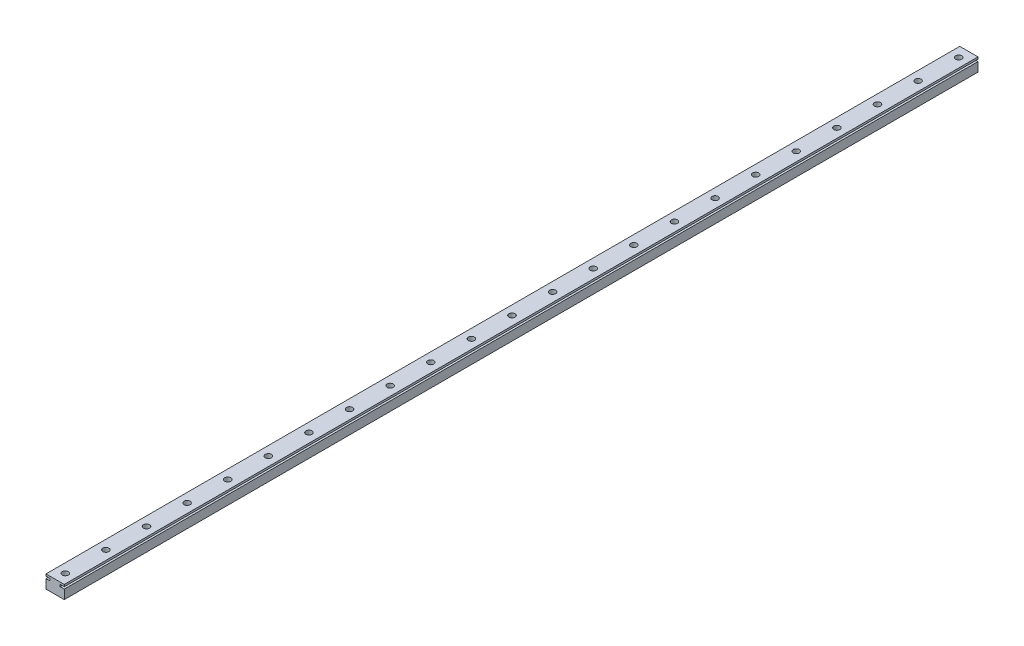
from build123d import *

# Parameters (mm, degrees)
SKETCH_1_W          = 9
SKETCH_1_H          = 6.5
EXTRUDE_1_DEPTH     = 450
SKETCH_2_W          = 2
SKETCH_2_H          = 1
CUT_EXTRUDE_1_DEPTH = 450
CUT_EXTRUDE_2_REACH = 452.137
SKETCH_3_R          = 1.5


with BuildPart() as part:
    # 草图1 → 凸台-拉伸1 (new body)
    with BuildSketch(Plane.XY):
        with Locations((-4.5, 3.25)):
            Rectangle(SKETCH_1_W, SKETCH_1_H)
    extrude(amount=EXTRUDE_1_DEPTH)

    # 草图2 → 切除-拉伸1 (cut)
    with BuildSketch(Plane(origin=(0, 0, 0), x_dir=(-1, 0, 0), z_dir=(0, 0, -1))):
        with Locations((1, 5)):
            Rectangle(SKETCH_2_W, SKETCH_2_H)
        with Locations((8, 5)):
            Rectangle(SKETCH_2_W, SKETCH_2_H)
    extrude(amount=-CUT_EXTRUDE_1_DEPTH, mode=Mode.SUBTRACT)

    # 草图3 → 切除-拉伸2 (cut, up to next)
    with BuildSketch(Plane(origin=(0, 6.5, 0), x_dir=(1, 0, 0), z_dir=(0, 1, 0)), mode=Mode.PRIVATE) as cut_extrude_2_sk1:
        with Locations((-4.5, -5)):
            Circle(SKETCH_3_R)
    cut_extrude_2_tool1 = extrude(cut_extrude_2_sk1.sketch, amount=-CUT_EXTRUDE_2_REACH, mode=Mode.PRIVATE) & part.part
    # 草图3 → 切除-拉伸2 (cut, up to next)
    with BuildSketch(Plane(origin=(0, 6.5, 0), x_dir=(1, 0, 0), z_dir=(0, 1, 0)), mode=Mode.PRIVATE) as cut_extrude_2_sk2:
        with Locations((-4.5, -25)):
            Circle(SKETCH_3_R)
    cut_extrude_2_tool2 = extrude(cut_extrude_2_sk2.sketch, amount=-CUT_EXTRUDE_2_REACH, mode=Mode.PRIVATE) & part.part
    # 草图3 → 切除-拉伸2 (cut, up to next)
    with BuildSketch(Plane(origin=(0, 6.5, 0), x_dir=(1, 0, 0), z_dir=(0, 1, 0)), mode=Mode.PRIVATE) as cut_extrude_2_sk3:
        with Locations((-4.5, -45)):
            Circle(SKETCH_3_R)
    cut_extrude_2_tool3 = extrude(cut_extrude_2_sk3.sketch, amount=-CUT_EXTRUDE_2_REACH, mode=Mode.PRIVATE) & part.part
    # 草图3 → 切除-拉伸2 (cut, up to next)
    with BuildSketch(Plane(origin=(0, 6.5, 0), x_dir=(1, 0, 0), z_dir=(0, 1, 0)), mode=Mode.PRIVATE) as cut_extrude_2_sk4:
        with Locations((-4.5, -65)):
            Circle(SKETCH_3_R)
    cut_extrude_2_tool4 = extrude(cut_extrude_2_sk4.sketch, amount=-CUT_EXTRUDE_2_REACH, mode=Mode.PRIVATE) & part.part
    # 草图3 → 切除-拉伸2 (cut, up to next)
    with BuildSketch(Plane(origin=(0, 6.5, 0), x_dir=(1, 0, 0), z_dir=(0, 1, 0)), mode=Mode.PRIVATE) as cut_extrude_2_sk5:
        with Locations((-4.5, -85)):
            Circle(SKETCH_3_R)
    cut_extrude_2_tool5 = extrude(cut_extrude_2_sk5.sketch, amount=-CUT_EXTRUDE_2_REACH, mode=Mode.PRIVATE) & part.part
    # 草图3 → 切除-拉伸2 (cut, up to next)
    with BuildSketch(Plane(origin=(0, 6.5, 0), x_dir=(1, 0, 0), z_dir=(0, 1, 0)), mode=Mode.PRIVATE) as cut_extrude_2_sk6:
        with Locations((-4.5, -105)):
            Circle(SKETCH_3_R)
    cut_extrude_2_tool6 = extrude(cut_extrude_2_sk6.sketch, amount=-CUT_EXTRUDE_2_REACH, mode=Mode.PRIVATE) & part.part
    # 草图3 → 切除-拉伸2 (cut, up to next)
    with BuildSketch(Plane(origin=(0, 6.5, 0), x_dir=(1, 0, 0), z_dir=(0, 1, 0)), mode=Mode.PRIVATE) as cut_extrude_2_sk7:
        with Locations((-4.5, -125)):
            Circle(SKETCH_3_R)
    cut_extrude_2_tool7 = extrude(cut_extrude_2_sk7.sketch, amount=-CUT_EXTRUDE_2_REACH, mode=Mode.PRIVATE) & part.part
    # 草图3 → 切除-拉伸2 (cut, up to next)
    with BuildSketch(Plane(origin=(0, 6.5, 0), x_dir=(1, 0, 0), z_dir=(0, 1, 0)), mode=Mode.PRIVATE) as cut_extrude_2_sk8:
        with Locations((-4.5, -145)):
            Circle(SKETCH_3_R)
    cut_extrude_2_tool8 = extrude(cut_extrude_2_sk8.sketch, amount=-CUT_EXTRUDE_2_REACH, mode=Mode.PRIVATE) & part.part
    # 草图3 → 切除-拉伸2 (cut, up to next)
    with BuildSketch(Plane(origin=(0, 6.5, 0), x_dir=(1, 0, 0), z_dir=(0, 1, 0)), mode=Mode.PRIVATE) as cut_extrude_2_sk9:
        with Locations((-4.5, -165)):
            Circle(SKETCH_3_R)
    cut_extrude_2_tool9 = extrude(cut_extrude_2_sk9.sketch, amount=-CUT_EXTRUDE_2_REACH, mode=Mode.PRIVATE) & part.part
    # 草图3 → 切除-拉伸2 (cut, up to next)
    with BuildSketch(Plane(origin=(0, 6.5, 0), x_dir=(1, 0, 0), z_dir=(0, 1, 0)), mode=Mode.PRIVATE) as cut_extrude_2_sk10:
        with Locations((-4.5, -185)):
            Circle(SKETCH_3_R)
    cut_extrude_2_tool10 = extrude(cut_extrude_2_sk10.sketch, amount=-CUT_EXTRUDE_2_REACH, mode=Mode.PRIVATE) & part.part
    # 草图3 → 切除-拉伸2 (cut, up to next)
    with BuildSketch(Plane(origin=(0, 6.5, 0), x_dir=(1, 0, 0), z_dir=(0, 1, 0)), mode=Mode.PRIVATE) as cut_extrude_2_sk11:
        with Locations((-4.5, -205)):
            Circle(SKETCH_3_R)
    cut_extrude_2_tool11 = extrude(cut_extrude_2_sk11.sketch, amount=-CUT_EXTRUDE_2_REACH, mode=Mode.PRIVATE) & part.part
    # 草图3 → 切除-拉伸2 (cut, up to next)
    with BuildSketch(Plane(origin=(0, 6.5, 0), x_dir=(1, 0, 0), z_dir=(0, 1, 0)), mode=Mode.PRIVATE) as cut_extrude_2_sk12:
        with Locations((-4.5, -225)):
            Circle(SKETCH_3_R)
    cut_extrude_2_tool12 = extrude(cut_extrude_2_sk12.sketch, amount=-CUT_EXTRUDE_2_REACH, mode=Mode.PRIVATE) & part.part
    # 草图3 → 切除-拉伸2 (cut, up to next)
    with BuildSketch(Plane(origin=(0, 6.5, 0), x_dir=(1, 0, 0), z_dir=(0, 1, 0)), mode=Mode.PRIVATE) as cut_extrude_2_sk13:
        with Locations((-4.5, -245)):
            Circle(SKETCH_3_R)
    cut_extrude_2_tool13 = extrude(cut_extrude_2_sk13.sketch, amount=-CUT_EXTRUDE_2_REACH, mode=Mode.PRIVATE) & part.part
    # 草图3 → 切除-拉伸2 (cut, up to next)
    with BuildSketch(Plane(origin=(0, 6.5, 0), x_dir=(1, 0, 0), z_dir=(0, 1, 0)), mode=Mode.PRIVATE) as cut_extrude_2_sk14:
        with Locations((-4.5, -265)):
            Circle(SKETCH_3_R)
    cut_extrude_2_tool14 = extrude(cut_extrude_2_sk14.sketch, amount=-CUT_EXTRUDE_2_REACH, mode=Mode.PRIVATE) & part.part
    # 草图3 → 切除-拉伸2 (cut, up to next)
    with BuildSketch(Plane(origin=(0, 6.5, 0), x_dir=(1, 0, 0), z_dir=(0, 1, 0)), mode=Mode.PRIVATE) as cut_extrude_2_sk15:
        with Locations((-4.5, -285)):
            Circle(SKETCH_3_R)
    cut_extrude_2_tool15 = extrude(cut_extrude_2_sk15.sketch, amount=-CUT_EXTRUDE_2_REACH, mode=Mode.PRIVATE) & part.part
    # 草图3 → 切除-拉伸2 (cut, up to next)
    with BuildSketch(Plane(origin=(0, 6.5, 0), x_dir=(1, 0, 0), z_dir=(0, 1, 0)), mode=Mode.PRIVATE) as cut_extrude_2_sk16:
        with Locations((-4.5, -305)):
            Circle(SKETCH_3_R)
    cut_extrude_2_tool16 = extrude(cut_extrude_2_sk16.sketch, amount=-CUT_EXTRUDE_2_REACH, mode=Mode.PRIVATE) & part.part
    # 草图3 → 切除-拉伸2 (cut, up to next)
    with BuildSketch(Plane(origin=(0, 6.5, 0), x_dir=(1, 0, 0), z_dir=(0, 1, 0)), mode=Mode.PRIVATE) as cut_extrude_2_sk17:
        with Locations((-4.5, -325)):
            Circle(SKETCH_3_R)
    cut_extrude_2_tool17 = extrude(cut_extrude_2_sk17.sketch, amount=-CUT_EXTRUDE_2_REACH, mode=Mode.PRIVATE) & part.part
    # 草图3 → 切除-拉伸2 (cut, up to next)
    with BuildSketch(Plane(origin=(0, 6.5, 0), x_dir=(1, 0, 0), z_dir=(0, 1, 0)), mode=Mode.PRIVATE) as cut_extrude_2_sk18:
        with Locations((-4.5, -345)):
            Circle(SKETCH_3_R)
    cut_extrude_2_tool18 = extrude(cut_extrude_2_sk18.sketch, amount=-CUT_EXTRUDE_2_REACH, mode=Mode.PRIVATE) & part.part
    # 草图3 → 切除-拉伸2 (cut, up to next)
    with BuildSketch(Plane(origin=(0, 6.5, 0), x_dir=(1, 0, 0), z_dir=(0, 1, 0)), mode=Mode.PRIVATE) as cut_extrude_2_sk19:
        with Locations((-4.5, -365)):
            Circle(SKETCH_3_R)
    cut_extrude_2_tool19 = extrude(cut_extrude_2_sk19.sketch, amount=-CUT_EXTRUDE_2_REACH, mode=Mode.PRIVATE) & part.part
    # 草图3 → 切除-拉伸2 (cut, up to next)
    with BuildSketch(Plane(origin=(0, 6.5, 0), x_dir=(1, 0, 0), z_dir=(0, 1, 0)), mode=Mode.PRIVATE) as cut_extrude_2_sk20:
        with Locations((-4.5, -385)):
            Circle(SKETCH_3_R)
    cut_extrude_2_tool20 = extrude(cut_extrude_2_sk20.sketch, amount=-CUT_EXTRUDE_2_REACH, mode=Mode.PRIVATE) & part.part
    # 草图3 → 切除-拉伸2 (cut, up to next)
    with BuildSketch(Plane(origin=(0, 6.5, 0), x_dir=(1, 0, 0), z_dir=(0, 1, 0)), mode=Mode.PRIVATE) as cut_extrude_2_sk21:
        with Locations((-4.5, -405)):
            Circle(SKETCH_3_R)
    cut_extrude_2_tool21 = extrude(cut_extrude_2_sk21.sketch, amount=-CUT_EXTRUDE_2_REACH, mode=Mode.PRIVATE) & part.part
    # 草图3 → 切除-拉伸2 (cut, up to next)
    with BuildSketch(Plane(origin=(0, 6.5, 0), x_dir=(1, 0, 0), z_dir=(0, 1, 0)), mode=Mode.PRIVATE) as cut_extrude_2_sk22:
        with Locations((-4.5, -425)):
            Circle(SKETCH_3_R)
    cut_extrude_2_tool22 = extrude(cut_extrude_2_sk22.sketch, amount=-CUT_EXTRUDE_2_REACH, mode=Mode.PRIVATE) & part.part
    # 草图3 → 切除-拉伸2 (cut, up to next)
    with BuildSketch(Plane(origin=(0, 6.5, 0), x_dir=(1, 0, 0), z_dir=(0, 1, 0)), mode=Mode.PRIVATE) as cut_extrude_2_sk23:
        with Locations((-4.5, -445)):
            Circle(SKETCH_3_R)
    cut_extrude_2_tool23 = extrude(cut_extrude_2_sk23.sketch, amount=-CUT_EXTRUDE_2_REACH, mode=Mode.PRIVATE) & part.part
    add(cut_extrude_2_tool1.solids().sort_by_distance((-4.5, 6.5, 5))[0], mode=Mode.SUBTRACT)
    add(cut_extrude_2_tool2.solids().sort_by_distance((-4.5, 6.5, 25))[0], mode=Mode.SUBTRACT)
    add(cut_extrude_2_tool3.solids().sort_by_distance((-4.5, 6.5, 45))[0], mode=Mode.SUBTRACT)
    add(cut_extrude_2_tool4.solids().sort_by_distance((-4.5, 6.5, 65))[0], mode=Mode.SUBTRACT)
    add(cut_extrude_2_tool5.solids().sort_by_distance((-4.5, 6.5, 85))[0], mode=Mode.SUBTRACT)
    add(cut_extrude_2_tool6.solids().sort_by_distance((-4.5, 6.5, 105))[0], mode=Mode.SUBTRACT)
    add(cut_extrude_2_tool7.solids().sort_by_distance((-4.5, 6.5, 125))[0], mode=Mode.SUBTRACT)
    add(cut_extrude_2_tool8.solids().sort_by_distance((-4.5, 6.5, 145))[0], mode=Mode.SUBTRACT)
    add(cut_extrude_2_tool9.solids().sort_by_distance((-4.5, 6.5, 165))[0], mode=Mode.SUBTRACT)
    add(cut_extrude_2_tool10.solids().sort_by_distance((-4.5, 6.5, 185))[0], mode=Mode.SUBTRACT)
    add(cut_extrude_2_tool11.solids().sort_by_distance((-4.5, 6.5, 205))[0], mode=Mode.SUBTRACT)
    add(cut_extrude_2_tool12.solids().sort_by_distance((-4.5, 6.5, 225))[0], mode=Mode.SUBTRACT)
    add(cut_extrude_2_tool13.solids().sort_by_distance((-4.5, 6.5, 245))[0], mode=Mode.SUBTRACT)
    add(cut_extrude_2_tool14.solids().sort_by_distance((-4.5, 6.5, 265))[0], mode=Mode.SUBTRACT)
    add(cut_extrude_2_tool15.solids().sort_by_distance((-4.5, 6.5, 285))[0], mode=Mode.SUBTRACT)
    add(cut_extrude_2_tool16.solids().sort_by_distance((-4.5, 6.5, 305))[0], mode=Mode.SUBTRACT)
    add(cut_extrude_2_tool17.solids().sort_by_distance((-4.5, 6.5, 325))[0], mode=Mode.SUBTRACT)
    add(cut_extrude_2_tool18.solids().sort_by_distance((-4.5, 6.5, 345))[0], mode=Mode.SUBTRACT)
    add(cut_extrude_2_tool19.solids().sort_by_distance((-4.5, 6.5, 365))[0], mode=Mode.SUBTRACT)
    add(cut_extrude_2_tool20.solids().sort_by_distance((-4.5, 6.5, 385))[0], mode=Mode.SUBTRACT)
    add(cut_extrude_2_tool21.solids().sort_by_distance((-4.5, 6.5, 405))[0], mode=Mode.SUBTRACT)
    add(cut_extrude_2_tool22.solids().sort_by_distance((-4.5, 6.5, 425))[0], mode=Mode.SUBTRACT)
    add(cut_extrude_2_tool23.solids().sort_by_distance((-4.5, 6.5, 445))[0], mode=Mode.SUBTRACT)


solid = part.part
